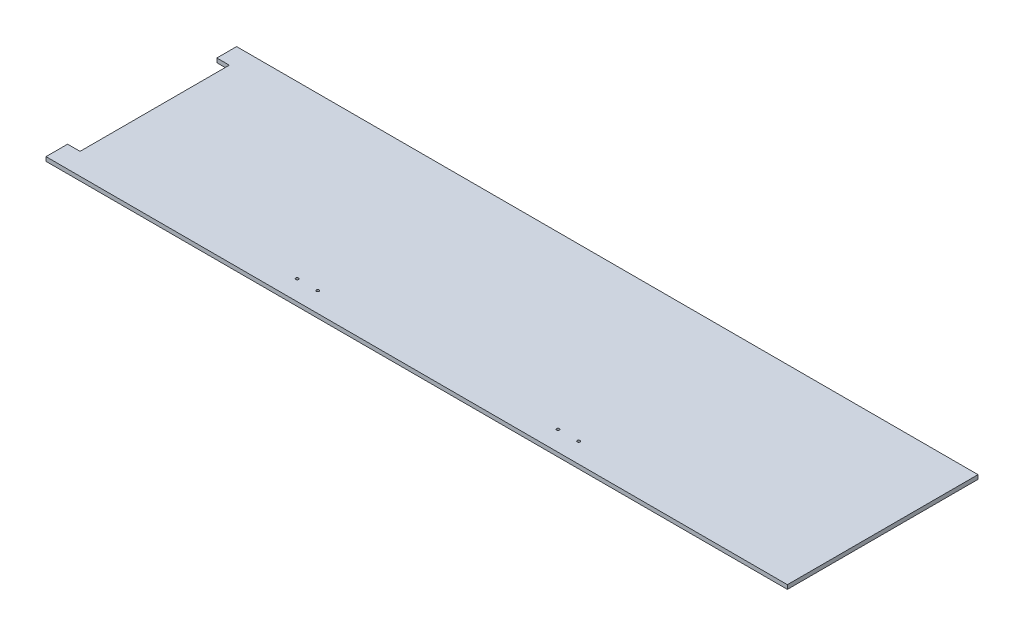
from build123d import *

# Parameters (mm, degrees)
SKETCH1_R           = 1
BOSS_EXTRUDE1_DEPTH = 3


with BuildPart() as part:
    # Sketch1 → Boss-Extrude1 (new body)
    with BuildSketch(Plane(origin=(0, 0, 0), x_dir=(1, 0, 0), z_dir=(0, 1, 0))):
        Polygon((-270, 55.03914276), (-260.924157622, 55.03914276), (-260.924157622, -53.680834093), (-270, -53.680834093), (-270, -69.412), (270, -69.412), (270, 69.412), (-270, 69.412), align=None)
        with Locations((-101.547872143, -54.974008218)):
            Circle(SKETCH1_R, mode=Mode.SUBTRACT)
        with Locations((-86.547872143, -54.974008218)):
            Circle(SKETCH1_R, mode=Mode.SUBTRACT)
        with Locations((88.467178103, -54.974008218)):
            Circle(SKETCH1_R, mode=Mode.SUBTRACT)
        with Locations((103.467178103, -54.974008218)):
            Circle(SKETCH1_R, mode=Mode.SUBTRACT)
    extrude(amount=BOSS_EXTRUDE1_DEPTH)


solid = part.part
